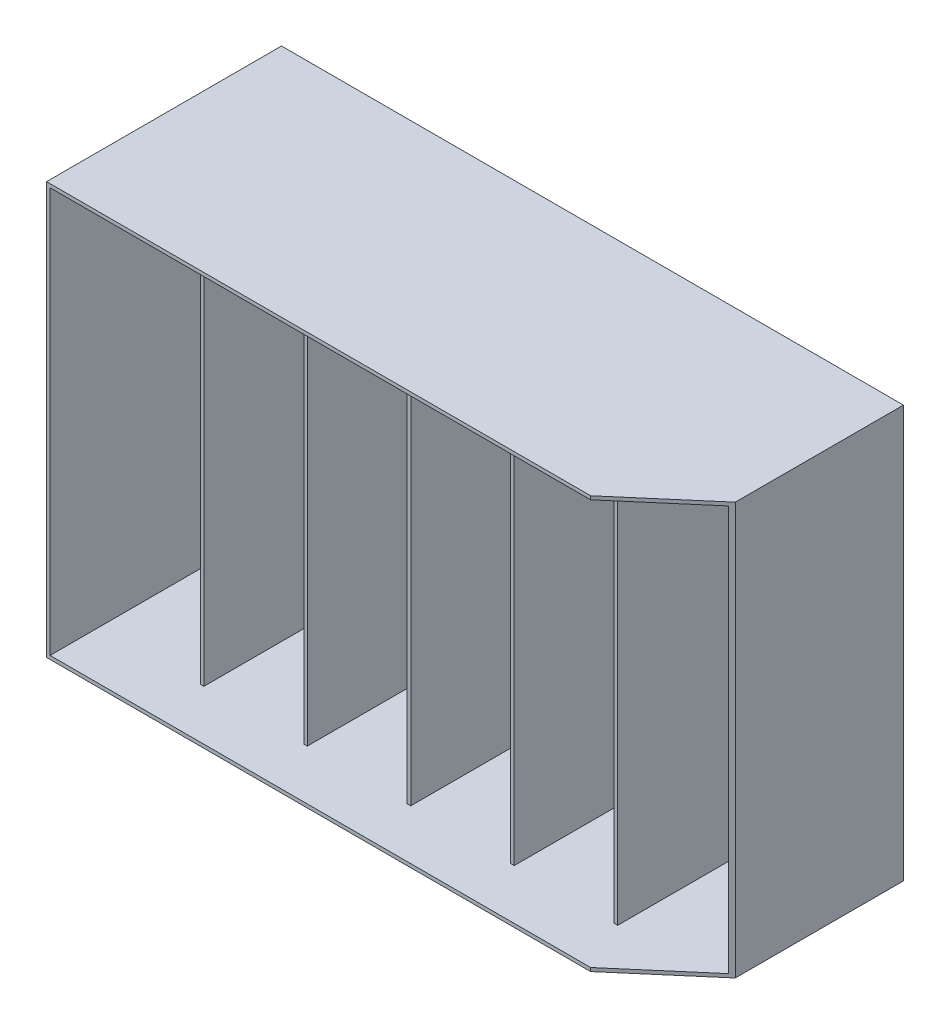
from build123d import *

# Parameters (mm, degrees)
SKETCH1_W           = 558.8
SKETCH1_H           = 370.25
BOSS_EXTRUDE1_DEPTH = 3.175
SKETCH2_W           = 558.8
SKETCH2_H           = 370.25
SKETCH2_W_2         = 87.469
SKETCH2_H_2         = 363.9
SKETCH2_W_3         = 89.789
SKETCH2_W_4         = 89.95
BOSS_EXTRUDE2_DEPTH = 162.9
SKETCH3_W           = 558.8
SKETCH3_H           = 370.25
BOSS_EXTRUDE3_DEPTH = 45
CUT_EXTRUDE1_DEPTH  = 510.609731191


with BuildPart() as part:
    # Sketch1 → Boss-Extrude1 (new body)
    with BuildSketch(Plane.XY):
        Rectangle(SKETCH1_W, SKETCH1_H)
    extrude(amount=BOSS_EXTRUDE1_DEPTH)

    # Sketch2 → Boss-Extrude2 (add)
    with BuildSketch(Plane.XY.offset(3.175)):
        Rectangle(SKETCH2_W, SKETCH2_H)
        with Locations((232.4905, 0)):
            Rectangle(SKETCH2_W_2, SKETCH2_H_2, mode=Mode.SUBTRACT)
        with Locations((140.6865, 0)):
            Rectangle(SKETCH2_W_3, SKETCH2_H_2, mode=Mode.SUBTRACT)
        with Locations((47.7225, 0)):
            Rectangle(SKETCH2_W_3, SKETCH2_H_2, mode=Mode.SUBTRACT)
        with Locations((-45.2415, 0)):
            Rectangle(SKETCH2_W_3, SKETCH2_H_2, mode=Mode.SUBTRACT)
        with Locations((-138.2055, 0)):
            Rectangle(SKETCH2_W_3, SKETCH2_H_2, mode=Mode.SUBTRACT)
        with Locations((-231.25, 0)):
            Rectangle(SKETCH2_W_4, SKETCH2_H_2, mode=Mode.SUBTRACT)
    extrude(amount=BOSS_EXTRUDE2_DEPTH)

    # Sketch3 → Boss-Extrude3 (add)
    with BuildSketch(Plane.XY.offset(166.075)):
        Rectangle(SKETCH3_W, SKETCH3_H)
        Polygon((188.756, 181.95), (276.225, 181.95), (276.225, -181.95), (188.756, -181.95), (185.581, -181.95), (95.792, -181.95), (92.617, -181.95), (2.828, -181.95), (-0.347, -181.95), (-90.136, -181.95), (-93.311, -181.95), (-183.1, -181.95), (-186.275, -181.95), (-276.225, -181.95), (-276.225, 181.95), (-186.275, 181.95), (-183.1, 181.95), (-93.311, 181.95), (-90.136, 181.95), (-0.347, 181.95), (2.828, 181.95), (92.617, 181.95), (95.792, 181.95), (185.581, 181.95), align=None, mode=Mode.SUBTRACT)
    extrude(amount=BOSS_EXTRUDE3_DEPTH)

    # Sketch4 → Cut-Extrude1 (cut, through all)
    with BuildSketch(Plane.XZ.offset(185.125)):
        Polygon((279.4, 211.075), (209.4, 211.075), (279.4, 151.075), align=None)
    extrude(amount=-CUT_EXTRUDE1_DEPTH, mode=Mode.SUBTRACT)


solid = part.part
